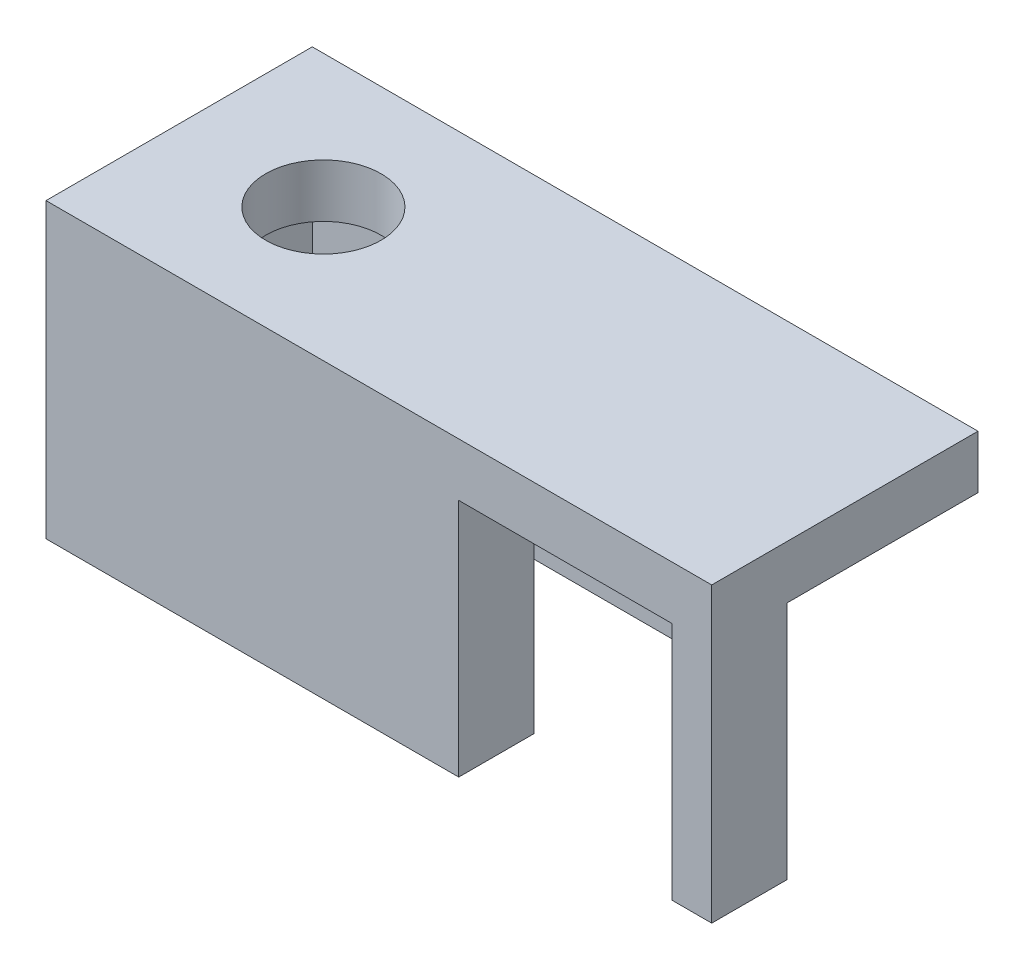
from build123d import *

# Parameters (mm, degrees)
SKETCH1_W           = 75
SKETCH1_H           = 30
BOSS_EXTRUDE1_DEPTH = 6
SKETCH2_W           = 4.5
SKETCH2_H           = 4.5
SKETCH2_W_2         = 38.5
SKETCH2_H_2         = 21
SKETCH2_W_3         = 5
SKETCH2_W_4         = 36
SKETCH2_W_5         = 6
SKETCH2_H_3         = 4
SKETCH2_H_4         = 8.5
BOSS_EXTRUDE4_DEPTH = 27
SKETCH7_W           = 4.5
SKETCH7_H           = 15
CUT_EXTRUDE1_DEPTH  = 6
SKETCH9_R           = 6.5
CUT_EXTRUDE2_DEPTH  = 30


with BuildPart() as part:
    # Sketch1 → Boss-Extrude1 (new body)
    with BuildSketch(Plane.XZ.offset(4.342044015)):
        with Locations((-49.069594933, 13.200391181)):
            Rectangle(SKETCH1_W, SKETCH1_H)
    extrude(amount=BOSS_EXTRUDE1_DEPTH)

    # Sketch2 → Boss-Extrude4 (add)
    with BuildSketch(Plane(origin=(0, -10.342044015, 0), x_dir=(-1, 0, 0), z_dir=(0, -1, 0))):
        with Locations((84.319594933, -0.450391181)):
            Rectangle(SKETCH2_W, SKETCH2_H)
        with Locations((62.819594933, -0.450391181)):
            Rectangle(SKETCH2_W_2, SKETCH2_H)
        with Locations((84.319594933, -13.200391181)):
            Rectangle(SKETCH2_W, SKETCH2_H_2)
        with Locations((41.069594933, -0.450391181)):
            Rectangle(SKETCH2_W_3, SKETCH2_H)
        with Locations((84.319594933, -25.950391181)):
            Rectangle(SKETCH2_W, SKETCH2_H)
        with Locations((41.069594933, -4.950391181)):
            Rectangle(SKETCH2_W_3, SKETCH2_H)
        with Locations((64.069594933, -25.950391181)):
            Rectangle(SKETCH2_W_4, SKETCH2_H)
        with Locations((43.069594933, -25.950391181)):
            Rectangle(SKETCH2_W_5, SKETCH2_H)
        with Locations((43.069594933, -21.700391181)):
            Rectangle(SKETCH2_W_5, SKETCH2_H_3)
        with Locations((13.819594933, -23.950391181)):
            Rectangle(SKETCH2_W, SKETCH2_H_4)
    extrude(amount=BOSS_EXTRUDE4_DEPTH)

    # Sketch7 → Cut-Extrude1 (cut)
    with BuildSketch(Plane(origin=(-38.569594933, 0, 0), x_dir=(0, 0, -1), z_dir=(1, 0, 0))):
        with Locations((-4.950391181, -29.842044015)):
            Rectangle(SKETCH7_W, SKETCH7_H)
    extrude(amount=-CUT_EXTRUDE1_DEPTH, mode=Mode.SUBTRACT)

    # Sketch9 → Cut-Extrude2 (cut)
    with BuildSketch(Plane(origin=(0, -4.342044015, 0), x_dir=(1, 0, 0), z_dir=(0, 1, 0))):
        with Locations((-70.319594933, -13.200391181)):
            Circle(SKETCH9_R)
    extrude(amount=-CUT_EXTRUDE2_DEPTH, mode=Mode.SUBTRACT)


solid = part.part
